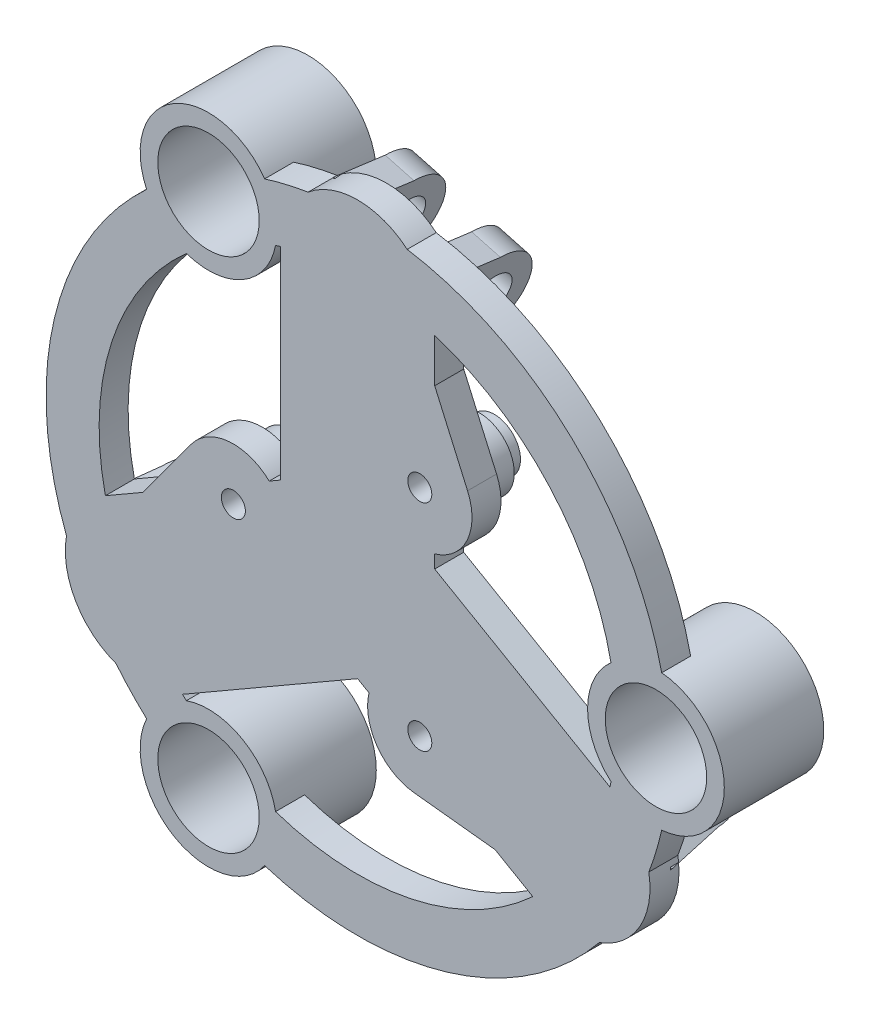
from build123d import *

# Parameters (mm, degrees)
F_01_START                              = 33.5
S01_JOINING_CENTRE_OF_FLOATING_Y_R      = 9
F_01_JOINING_CENTRE_OF_FLOATING_Y_DEPTH = 3.5
F_02_START                              = 33.5
F_02_FLOATING_SPOKE_1_DEPTH             = 3.5
F_03_START                              = 33.5
F_03_FLOATING_SPOKE_2_DEPTH             = 3.5
F_04_START                              = 33.5
F_04_FLOATING_SPOKE_3_DEPTH             = 3.5
F_05_START                              = 33.5
F_05_MOVING_TENDON_TIE_WEB_1_DEPTH      = 3.5
F_06_START                              = 29.8
S06_TENDON_ANCHOR_BASE_1_R              = 4.2
F_06_TENDON_ANCHOR_BASE_1_DEPTH         = 3.7
F_07_START                              = 28
S07_TENDON_MOUTH_1_R                    = 3.15
F_07_TENDON_MOUTH_1_DEPTH               = 1.8
F_08_START                              = 33.5
F_08_MOVING_TENDON_TIE_WEB_2_DEPTH      = 3.5
F_09_START                              = 29.8
S09_TENDON_ANCHOR_BASE_2_R              = 4.2
F_09_TENDON_ANCHOR_BASE_2_DEPTH         = 3.7
F_10_START                              = 28
S10_TENDON_MOUTH_2_R                    = 3.15
F_10_TENDON_MOUTH_2_DEPTH               = 1.8
F_11_START                              = 33.5
F_11_MOVING_TENDON_TIE_WEB_3_DEPTH      = 3.5
F_12_START                              = 29.8
S12_TENDON_ANCHOR_BASE_3_R              = 4.2
F_12_TENDON_ANCHOR_BASE_3_DEPTH         = 3.7
F_13_START                              = 28
S13_TENDON_MOUTH_3_R                    = 3.15
F_13_TENDON_MOUTH_3_DEPTH               = 1.8
F_14_START                              = 33.5
S14_JOINED_DRIVE_HOOP_R                 = 37.6
S14_JOINED_DRIVE_HOOP_R_2               = 31.2
F_14_JOINED_DRIVE_HOOP_DEPTH            = 3.5
F_15_START                              = 25
S15_SLIDING_GUIDE_BARREL_1_R            = 8.25
F_15_SLIDING_GUIDE_BARREL_1_DEPTH       = 12
F_16_START                              = 25
S16_SLIDING_GUIDE_BARREL_2_R            = 8.25
F_16_SLIDING_GUIDE_BARREL_2_DEPTH       = 12
F_17_START                              = 25
S17_SLIDING_GUIDE_BARREL_3_R            = 8.25
F_17_SLIDING_GUIDE_BARREL_3_DEPTH       = 12
F_18_START                              = 24
S18_GUIDE_BUSHING_SEATS_R               = 6.12
F_18_GUIDE_BUSHING_SEATS_DEPTH          = 14
F_19_START                              = 27.8
S19_THROUGH_TENDON_TIE_EYES_R           = 1.45
F_19_THROUGH_TENDON_TIE_EYES_DEPTH      = 10
F_20_START                              = -7.2
F_20_INTEGRAL_B1_FORK_CHEEK_L_DEPTH     = 3.6
F_21_START                              = 3.6
F_21_INTEGRAL_B1_FORK_CHEEK_R_DEPTH     = 3.6
F_22_START                              = -7.5
S22_B1_PIVOT_THROUGH_BOTH_CHEEKS_R      = 1.65
F_22_B1_PIVOT_THROUGH_BOTH_CHEEKS_DEPTH = 15
F_23_START                              = -7.3
S23_B1_RECESSED_PIVOT_SCREW_HEAD_R      = 2.7
F_23_B1_RECESSED_PIVOT_SCREW_HEAD_DEPTH = 1.5
F_24_START                              = -7.2
F_24_INTEGRAL_B2_FORK_CHEEK_L_DEPTH     = 3.6
F_25_START                              = 3.6
F_25_INTEGRAL_B2_FORK_CHEEK_R_DEPTH     = 3.6
F_26_START                              = -7.5
S26_B2_PIVOT_THROUGH_BOTH_CHEEKS_R      = 2.6
F_26_B2_PIVOT_THROUGH_BOTH_CHEEKS_DEPTH = 15
F_27_START                              = -7.3
S27_B2_RECESSED_PIVOT_SCREW_HEAD_R      = 2.7
F_27_B2_RECESSED_PIVOT_SCREW_HEAD_DEPTH = 1.5
F_28_START                              = -7.2
F_28_INTEGRAL_B3_FORK_CHEEK_L_DEPTH     = 3.6
F_29_START                              = 3.6
F_29_INTEGRAL_B3_FORK_CHEEK_R_DEPTH     = 3.6
F_30_START                              = -7.5
S30_B3_PIVOT_THROUGH_BOTH_CHEEKS_R      = 2.6
F_30_B3_PIVOT_THROUGH_BOTH_CHEEKS_DEPTH = 15
F_31_START                              = -7.3
S31_B3_RECESSED_PIVOT_SCREW_HEAD_R      = 2.7
F_31_B3_RECESSED_PIVOT_SCREW_HEAD_DEPTH = 1.5
CUT_EXTRUDE1_DEPTH                      = 71.085181941
CUT_EXTRUDE1_DEPTH_BACK                 = 16
SKETCH1_R                               = 2.6


with BuildPart() as part:
    # S01 - Joining centre of floating Y → 01 - Joining centre of floating Y (new body)
    with BuildSketch(Plane.XY.offset(F_01_START)):
        Circle(S01_JOINING_CENTRE_OF_FLOATING_Y_R)
    extrude(amount=F_01_JOINING_CENTRE_OF_FLOATING_Y_DEPTH)

    # S02 - Floating spoke 1 → 02 - Floating spoke 1 (add)
    with BuildSketch(Plane.XY.offset(F_02_START)):
        with BuildLine():
            Line((4.65, -8.054036255), (-21.330762114, -23.054036255))
            ThreePointArc((-21.330762114, -23.054036255), (-34.034798369, -19.65), (-30.630762114, -6.945963745))
            Line((-30.630762114, -6.945963745), (-4.65, 8.054036255))
            ThreePointArc((-4.65, 8.054036255), (8.054036255, 4.65), (4.65, -8.054036255))
        make_face()
    extrude(amount=F_02_FLOATING_SPOKE_1_DEPTH)

    # S03 - Floating spoke 2 → 03 - Floating spoke 2 (add)
    with BuildSketch(Plane.XY.offset(F_03_START)):
        with BuildLine():
            Line((4.65, 8.054036255), (30.630762114, -6.945963745))
            ThreePointArc((30.630762114, -6.945963745), (34.034798369, -19.65), (21.330762114, -23.054036255))
            Line((21.330762114, -23.054036255), (-4.65, -8.054036255))
            ThreePointArc((-4.65, -8.054036255), (-8.054036255, 4.65), (4.65, 8.054036255))
        make_face()
    extrude(amount=F_03_FLOATING_SPOKE_2_DEPTH)

    # S04 - Floating spoke 3 → 04 - Floating spoke 3 (add)
    with BuildSketch(Plane.XY.offset(F_04_START)):
        with BuildLine():
            Line((-9.3, 0), (-9.3, 30))
            ThreePointArc((-9.3, 30), (0, 39.3), (9.3, 30))
            Line((9.3, 30), (9.3, 0))
            ThreePointArc((9.3, 0), (0, -9.3), (-9.3, 0))
        make_face()
    extrude(amount=F_04_FLOATING_SPOKE_3_DEPTH)

    # S05 - Moving tendon tie web 1 → 05 - Moving tendon tie web 1 (add)
    with BuildSketch(Plane.XY.offset(F_05_START)):
        with BuildLine():
            Line((25.299707774, -21.263079513), (6.818945661, -19.25346057))
            ThreePointArc((6.818945661, -19.25346057), (1.236920487, -12.309326717), (8.181054339, -6.727301544))
            Line((8.181054339, -6.727301544), (26.661816453, -8.736920487))
            ThreePointArc((26.661816453, -8.736920487), (32.243841627, -15.681054339), (25.299707774, -21.263079513))
        make_face()
    extrude(amount=F_05_MOVING_TENDON_TIE_WEB_1_DEPTH)

    # S06 - Tendon anchor base 1 → 06 - Tendon anchor base 1 (add)
    with BuildSketch(Plane.XY.offset(F_06_START)):
        with Locations((7.5, -12.990381057)):
            Circle(S06_TENDON_ANCHOR_BASE_1_R)
    extrude(amount=F_06_TENDON_ANCHOR_BASE_1_DEPTH)

    # S07 - Tendon mouth 1 → 07 - Tendon mouth 1 (add)
    with BuildSketch(Plane.XY.offset(F_07_START)):
        with Locations((7.5, -12.990381057)):
            Circle(S07_TENDON_MOUTH_1_R)
    extrude(amount=F_07_TENDON_MOUTH_1_DEPTH)

    # S08 - Moving tendon tie web 2 → 08 - Moving tendon tie web 2 (add)
    with BuildSketch(Plane.XY.offset(F_08_START)):
        with BuildLine():
            Line((5.764513134, 32.541729397), (13.264513134, 15.532110454))
            ThreePointArc((13.264513134, 15.532110454), (10.041729397, 7.225867923), (1.735486866, 10.448651659))
            Line((1.735486866, 10.448651659), (-5.764513134, 27.458270603))
            ThreePointArc((-5.764513134, 27.458270603), (-2.541729397, 35.764513134), (5.764513134, 32.541729397))
        make_face()
    extrude(amount=F_08_MOVING_TENDON_TIE_WEB_2_DEPTH)

    # S09 - Tendon anchor base 2 → 09 - Tendon anchor base 2 (add)
    with BuildSketch(Plane.XY.offset(F_09_START)):
        with Locations((7.5, 12.990381057)):
            Circle(S09_TENDON_ANCHOR_BASE_2_R)
    extrude(amount=F_09_TENDON_ANCHOR_BASE_2_DEPTH)

    # S10 - Tendon mouth 2 → 10 - Tendon mouth 2 (add)
    with BuildSketch(Plane.XY.offset(F_10_START)):
        with Locations((7.5, 12.990381057)):
            Circle(S10_TENDON_MOUTH_2_R)
    extrude(amount=F_10_TENDON_MOUTH_2_DEPTH)

    # S11 - Moving tendon tie web 3 → 11 - Moving tendon tie web 3 (add)
    with BuildSketch(Plane.XY.offset(F_11_START)):
        with BuildLine():
            Line((-31.064220908, -11.278649884), (-20.083458795, 3.721350116))
            ThreePointArc((-20.083458795, 3.721350116), (-11.278649884, 5.083458795), (-9.916541205, -3.721350116))
            Line((-9.916541205, -3.721350116), (-20.897303319, -18.721350116))
            ThreePointArc((-20.897303319, -18.721350116), (-29.702112229, -20.083458795), (-31.064220908, -11.278649884))
        make_face()
    extrude(amount=F_11_MOVING_TENDON_TIE_WEB_3_DEPTH)

    # S12 - Tendon anchor base 3 → 12 - Tendon anchor base 3 (add)
    with BuildSketch(Plane.XY.offset(F_12_START)):
        with Locations((-15, 0)):
            Circle(S12_TENDON_ANCHOR_BASE_3_R)
    extrude(amount=F_12_TENDON_ANCHOR_BASE_3_DEPTH)

    # S13 - Tendon mouth 3 → 13 - Tendon mouth 3 (add)
    with BuildSketch(Plane.XY.offset(F_13_START)):
        with Locations((-15, 0)):
            Circle(S13_TENDON_MOUTH_3_R)
    extrude(amount=F_13_TENDON_MOUTH_3_DEPTH)

    # S14 - Joined drive hoop → 14 - Joined drive hoop (add)
    with BuildSketch(Plane.XY.offset(F_14_START)):
        Circle(S14_JOINED_DRIVE_HOOP_R)
        Circle(S14_JOINED_DRIVE_HOOP_R_2, mode=Mode.SUBTRACT)
    extrude(amount=F_14_JOINED_DRIVE_HOOP_DEPTH)

    # S15 - Sliding guide barrel 1 → 15 - Sliding guide barrel 1 (add)
    with BuildSketch(Plane.XY.offset(F_15_START)):
        with Locations((36, 0)):
            Circle(S15_SLIDING_GUIDE_BARREL_1_R)
    extrude(amount=F_15_SLIDING_GUIDE_BARREL_1_DEPTH)

    # S16 - Sliding guide barrel 2 → 16 - Sliding guide barrel 2 (add)
    with BuildSketch(Plane.XY.offset(F_16_START)):
        with Locations((-18, 31.176914536)):
            Circle(S16_SLIDING_GUIDE_BARREL_2_R)
    extrude(amount=F_16_SLIDING_GUIDE_BARREL_2_DEPTH)

    # S17 - Sliding guide barrel 3 → 17 - Sliding guide barrel 3 (add)
    with BuildSketch(Plane.XY.offset(F_17_START)):
        with Locations((-18, -31.176914536)):
            Circle(S17_SLIDING_GUIDE_BARREL_3_R)
    extrude(amount=F_17_SLIDING_GUIDE_BARREL_3_DEPTH)

    # S18 - Guide bushing seats → 18 - Guide bushing seats (cut)
    with BuildSketch(Plane.XY.offset(F_18_START)):
        with Locations((36, 0)):
            Circle(S18_GUIDE_BUSHING_SEATS_R)
        with Locations((-18, 31.176914536)):
            Circle(S18_GUIDE_BUSHING_SEATS_R)
        with Locations((-18, -31.176914536)):
            Circle(S18_GUIDE_BUSHING_SEATS_R)
    extrude(amount=F_18_GUIDE_BUSHING_SEATS_DEPTH, mode=Mode.SUBTRACT)

    # S19 - Through tendon tie eyes → 19 - Through tendon tie eyes (cut)
    with BuildSketch(Plane.XY.offset(F_19_START)):
        with Locations((7.5, -12.990381057)):
            Circle(S19_THROUGH_TENDON_TIE_EYES_R)
        with Locations((7.5, 12.990381057)):
            Circle(S19_THROUGH_TENDON_TIE_EYES_R)
        with Locations((-15, 0)):
            Circle(S19_THROUGH_TENDON_TIE_EYES_R)
    extrude(amount=F_19_THROUGH_TENDON_TIE_EYES_DEPTH, mode=Mode.SUBTRACT)

    # S20 - Integral B1 fork cheek L → 20 - Integral B1 fork cheek L (add)
    with BuildSketch(Plane(origin=(2.009618943, -7.5, 0), x_dir=(0.9659258262890683, 0.2588190451025208, 0), z_dir=(-0.2588190451025208, 0.9659258262890684, 0)).offset(F_20_START)):
        with BuildLine():
            Line((-35.077774789, -34.5), (-22.877774789, -34.5))
            Line((-22.877774789, -34.5), (-24.027774789, -28))
            ThreePointArc((-24.027774789, -28), (-28.977774789, -23.05), (-33.927774789, -28))
            Line((-33.927774789, -28), (-35.077774789, -34.5))
        make_face()
    extrude(amount=F_20_INTEGRAL_B1_FORK_CHEEK_L_DEPTH)

    # S21 - Integral B1 fork cheek R → 21 - Integral B1 fork cheek R (add)
    with BuildSketch(Plane(origin=(2.009618943, -7.5, 0), x_dir=(0.9659258262890683, 0.2588190451025208, 0), z_dir=(-0.2588190451025208, 0.9659258262890684, 0)).offset(F_21_START)):
        with BuildLine():
            Line((-35.077774789, -34.5), (-22.877774789, -34.5))
            Line((-22.877774789, -34.5), (-24.027774789, -28))
            ThreePointArc((-24.027774789, -28), (-28.977774789, -23.05), (-33.927774789, -28))
            Line((-33.927774789, -28), (-35.077774789, -34.5))
        make_face()
    extrude(amount=F_21_INTEGRAL_B1_FORK_CHEEK_R_DEPTH)

    # S22 - B1 pivot through both cheeks → 22 - B1 pivot through both cheeks (cut)
    with BuildSketch(Plane(origin=(2.009618943, -7.5, 0), x_dir=(0.9659258262890683, 0.2588190451025208, 0), z_dir=(-0.2588190451025208, 0.9659258262890684, 0)).offset(F_22_START)):
        with Locations((-28.977774789, -28)):
            Circle(S22_B1_PIVOT_THROUGH_BOTH_CHEEKS_R)
    extrude(amount=F_22_B1_PIVOT_THROUGH_BOTH_CHEEKS_DEPTH, mode=Mode.SUBTRACT)

    # S23 - B1 recessed pivot screw head → 23 - B1 recessed pivot screw head (cut)
    with BuildSketch(Plane(origin=(2.009618943, -7.5, 0), x_dir=(0.9659258262890683, 0.2588190451025208, 0), z_dir=(-0.2588190451025208, 0.9659258262890684, 0)).offset(F_23_START)):
        with Locations((-28.977774789, -28)):
            Circle(S23_B1_RECESSED_PIVOT_SCREW_HEAD_R)
    extrude(amount=F_23_B1_RECESSED_PIVOT_SCREW_HEAD_DEPTH, mode=Mode.SUBTRACT)

    # S24 - Integral B2 fork cheek L → 24 - Integral B2 fork cheek L (add)
    with BuildSketch(Plane(origin=(5.490381057, 5.490381057, 0), x_dir=(0, 0, 1), z_dir=(-0.7071067811865476, -0.7071067811865475, 0)).offset(F_24_START)):
        with BuildLine():
            Line((34.5, -35.077774789), (34.5, -22.877774789))
            Line((34.5, -22.877774789), (28, -24.027774789))
            ThreePointArc((28, -24.027774789), (23.05, -28.977774789), (28, -33.927774789))
            Line((28, -33.927774789), (34.5, -35.077774789))
        make_face()
    extrude(amount=F_24_INTEGRAL_B2_FORK_CHEEK_L_DEPTH)

    # S25 - Integral B2 fork cheek R → 25 - Integral B2 fork cheek R (add)
    with BuildSketch(Plane(origin=(5.490381057, 5.490381057, 0), x_dir=(0, 0, 1), z_dir=(-0.7071067811865476, -0.7071067811865475, 0)).offset(F_25_START)):
        with BuildLine():
            Line((34.5, -35.077774789), (34.5, -22.877774789))
            Line((34.5, -22.877774789), (28, -24.027774789))
            ThreePointArc((28, -24.027774789), (23.05, -28.977774789), (28, -33.927774789))
            Line((28, -33.927774789), (34.5, -35.077774789))
        make_face()
    extrude(amount=F_25_INTEGRAL_B2_FORK_CHEEK_R_DEPTH)

    # S26 - B2 pivot through both cheeks → 26 - B2 pivot through both cheeks (cut)
    with BuildSketch(Plane(origin=(5.490381057, 5.490381057, 0), x_dir=(0, 0, 1), z_dir=(-0.7071067811865476, -0.7071067811865475, 0)).offset(F_26_START)):
        with Locations((28, -28.977774789)):
            Circle(S26_B2_PIVOT_THROUGH_BOTH_CHEEKS_R)
    extrude(amount=F_26_B2_PIVOT_THROUGH_BOTH_CHEEKS_DEPTH, mode=Mode.SUBTRACT)

    # S27 - B2 recessed pivot screw head → 27 - B2 recessed pivot screw head (cut)
    with BuildSketch(Plane(origin=(5.490381057, 5.490381057, 0), x_dir=(0, 0, 1), z_dir=(-0.7071067811865476, -0.7071067811865475, 0)).offset(F_27_START)):
        with Locations((28, -28.977774789)):
            Circle(S27_B2_RECESSED_PIVOT_SCREW_HEAD_R)
    extrude(amount=F_27_B2_RECESSED_PIVOT_SCREW_HEAD_DEPTH, mode=Mode.SUBTRACT)

    # S28 - Integral B3 fork cheek L → 28 - Integral B3 fork cheek L (add)
    with BuildSketch(Plane(origin=(-7.5, 2.009618943, 0), x_dir=(0, 0, -1), z_dir=(0.9659258262890683, -0.25881904510252113, 0)).offset(F_28_START)):
        with BuildLine():
            Line((-34.5, 35.077774789), (-34.5, 22.877774789))
            Line((-34.5, 22.877774789), (-28, 24.027774789))
            ThreePointArc((-28, 24.027774789), (-23.05, 28.977774789), (-28, 33.927774789))
            Line((-28, 33.927774789), (-34.5, 35.077774789))
        make_face()
    extrude(amount=F_28_INTEGRAL_B3_FORK_CHEEK_L_DEPTH)

    # S29 - Integral B3 fork cheek R → 29 - Integral B3 fork cheek R (add)
    with BuildSketch(Plane(origin=(-7.5, 2.009618943, 0), x_dir=(0, 0, -1), z_dir=(0.9659258262890683, -0.25881904510252113, 0)).offset(F_29_START)):
        with BuildLine():
            Line((-34.5, 35.077774789), (-34.5, 22.877774789))
            Line((-34.5, 22.877774789), (-28, 24.027774789))
            ThreePointArc((-28, 24.027774789), (-23.05, 28.977774789), (-28, 33.927774789))
            Line((-28, 33.927774789), (-34.5, 35.077774789))
        make_face()
    extrude(amount=F_29_INTEGRAL_B3_FORK_CHEEK_R_DEPTH)

    # S30 - B3 pivot through both cheeks → 30 - B3 pivot through both cheeks (cut)
    with BuildSketch(Plane(origin=(-7.5, 2.009618943, 0), x_dir=(0, 0, -1), z_dir=(0.9659258262890683, -0.25881904510252113, 0)).offset(F_30_START)):
        with Locations((-28, 28.977774789)):
            Circle(S30_B3_PIVOT_THROUGH_BOTH_CHEEKS_R)
    extrude(amount=F_30_B3_PIVOT_THROUGH_BOTH_CHEEKS_DEPTH, mode=Mode.SUBTRACT)

    # S31 - B3 recessed pivot screw head → 31 - B3 recessed pivot screw head (cut)
    with BuildSketch(Plane(origin=(-7.5, 2.009618943, 0), x_dir=(0, 0, -1), z_dir=(0.9659258262890683, -0.25881904510252113, 0)).offset(F_31_START)):
        with Locations((-28, 28.977774789)):
            Circle(S31_B3_RECESSED_PIVOT_SCREW_HEAD_R)
    extrude(amount=F_31_B3_RECESSED_PIVOT_SCREW_HEAD_DEPTH, mode=Mode.SUBTRACT)

    # Sketch1 → Cut-Extrude1 (cut, two sides: drawn at the far end of the back side and taken through both)
    with BuildSketch(Plane(origin=(0.146121818, -0.545334051, 0), x_dir=(0.9659258262890683, 0.25881904510252085, 0), z_dir=(-0.2588190451025208, 0.9659258262890682, 0)).offset(-CUT_EXTRUDE1_DEPTH_BACK)):
        with Locations((-28.977774789, -28)):
            Circle(SKETCH1_R)
    extrude(amount=CUT_EXTRUDE1_DEPTH + CUT_EXTRUDE1_DEPTH_BACK, mode=Mode.SUBTRACT)


solid = part.part
